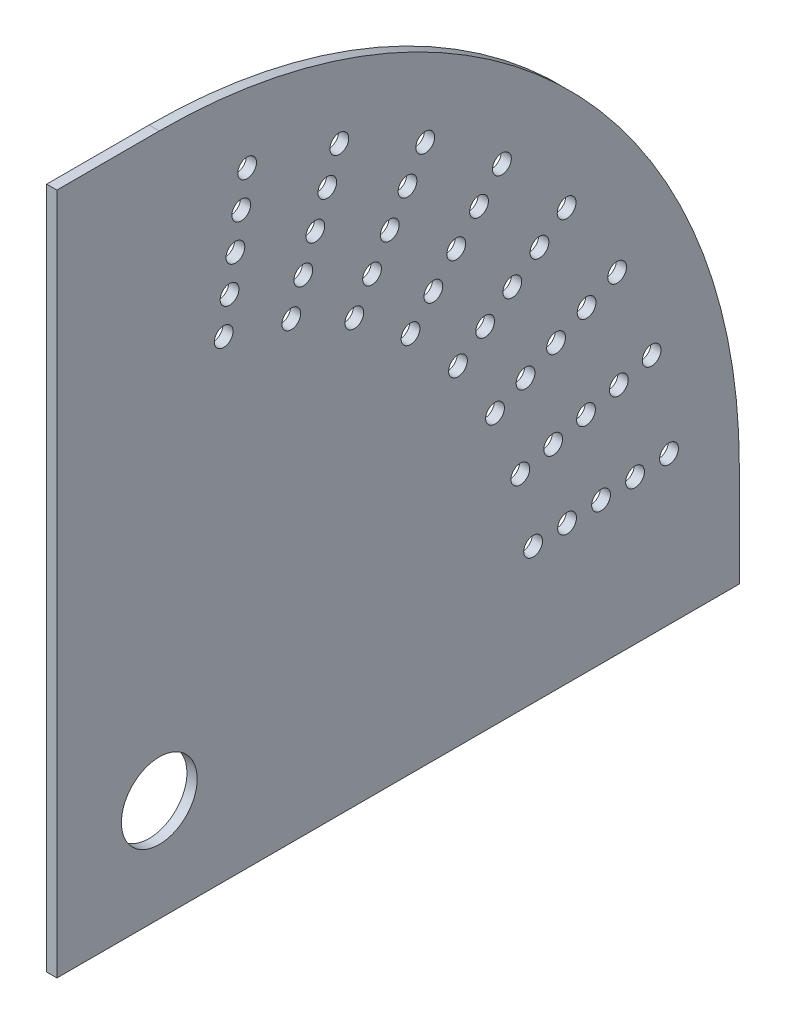
from build123d import *

# Parameters (mm, degrees)
SKETCH1_W           = 200
SKETCH1_H           = 200
SKETCH1_R           = 11.11
BOSS_EXTRUDE1_DEPTH = 3
CUT_EXTRUDE1_DEPTH  = 3
SKETCH3_R           = 2.75
CUT_EXTRUDE2_DEPTH  = 3
CIRPATTERN1_COUNT   = 8
CIRPATTERN1_ANGLE   = 75


with BuildPart() as part:
    # Sketch1 → Boss-Extrude1 (new body)
    with BuildSketch(Plane(origin=(0, 0, 0), x_dir=(0, 0, -1), z_dir=(1, 0, 0))):
        with Locations((100, 100)):
            Rectangle(SKETCH1_W, SKETCH1_H)
        with Locations((30, 30)):
            Circle(SKETCH1_R, mode=Mode.SUBTRACT)
    extrude(amount=BOSS_EXTRUDE1_DEPTH)

    # Sketch2 → Cut-Extrude1 (cut)
    with BuildSketch(Plane(origin=(3, 0, 0), x_dir=(0, 0, -1), z_dir=(1, 0, 0))):
        with BuildLine():
            Line((30, 200), (0, 200))
            Line((0, 200), (3.796539521, 239.334184814))
            Line((3.796539521, 239.334184814), (230.764554348, 219.667092407))
            Line((230.764554348, 219.667092407), (249.486387155, 45.6174058))
            Line((249.486387155, 45.6174058), (200, 30))
            ThreePointArc((200, 30), (150.208152802, 150.208152802), (30, 200))
        make_face()
    extrude(amount=-CUT_EXTRUDE1_DEPTH, mode=Mode.SUBTRACT)

    # Sketch3 → Cut-Extrude2 (cut)
    with BuildSketch(Plane(origin=(3, 0, 0), x_dir=(0, 0, -1), z_dir=(1, 0, 0))):
        with Locations((55.744765054, 177.774175932)):
            Circle(SKETCH3_R)
        with Locations((54.028447384, 167.922564203)):
            Circle(SKETCH3_R)
        with Locations((52.312129713, 158.070952474)):
            Circle(SKETCH3_R)
        with Locations((50.595812043, 148.219340745)):
            Circle(SKETCH3_R)
        with Locations((48.879494373, 138.367729017)):
            Circle(SKETCH3_R)
    cut_extrude2 = extrude(amount=-CUT_EXTRUDE2_DEPTH, mode=Mode.SUBTRACT)

    # CirPattern1: Cut-Extrude2 ×8 about axis
    cirpattern1_axis = Axis((3, 30, -30), (-1, 0, 0))
    for i in range(1, CIRPATTERN1_COUNT):
        add(cut_extrude2.rotate(cirpattern1_axis, i * CIRPATTERN1_ANGLE / (CIRPATTERN1_COUNT - 1)), mode=Mode.SUBTRACT)


solid = part.part
